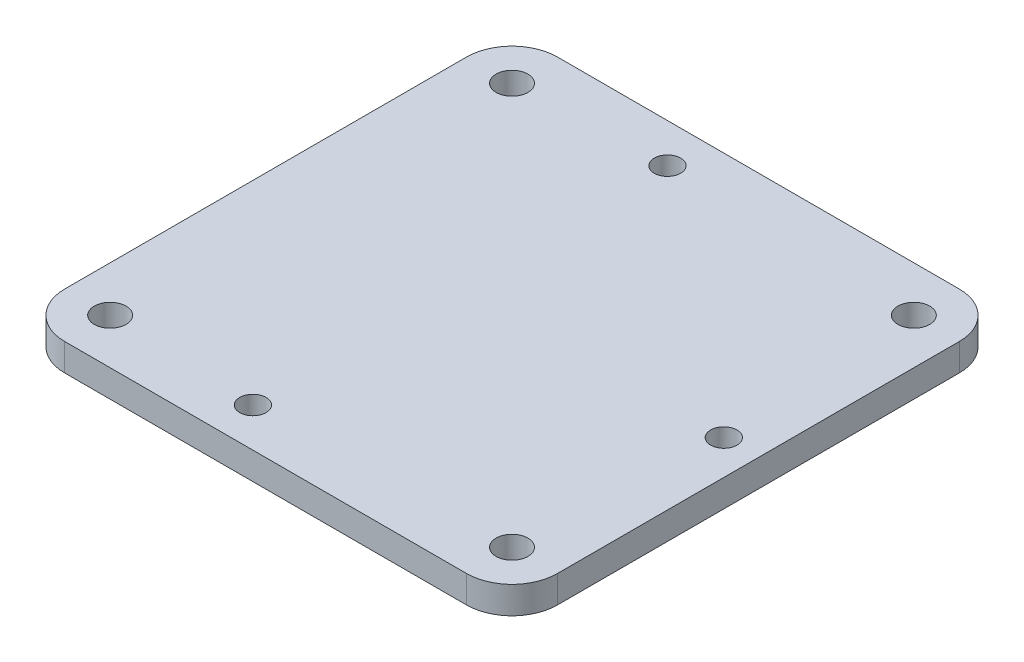
from build123d import *

# Parameters (mm, degrees)
SKETCH1_W           = 54.2
SKETCH1_H           = 54.2
SKETCH1_R           = 1.45
SKETCH1_R_2         = 1.75
BOSS_EXTRUDE1_DEPTH = 3
FILLET1_R           = 5


with BuildPart() as part:
    # Sketch1 → Boss-Extrude1 (new body)
    with BuildSketch(Plane(origin=(0, 0, 0), x_dir=(1, 0, 0), z_dir=(0, 1, 0))):
        with Locations((27.1, 27.1)):
            Rectangle(SKETCH1_W, SKETCH1_H)
        with Locations((21.4, 49.9)):
            Circle(SKETCH1_R, mode=Mode.SUBTRACT)
        with Locations((21.4, 4.3)):
            Circle(SKETCH1_R, mode=Mode.SUBTRACT)
        with Locations((50.4, 27.1)):
            Circle(SKETCH1_R, mode=Mode.SUBTRACT)
        with Locations((5, 49.2)):
            Circle(SKETCH1_R_2, mode=Mode.SUBTRACT)
        with Locations((49.2, 49.2)):
            Circle(SKETCH1_R_2, mode=Mode.SUBTRACT)
        with Locations((49.2, 5)):
            Circle(SKETCH1_R_2, mode=Mode.SUBTRACT)
        with Locations((5, 5)):
            Circle(SKETCH1_R_2, mode=Mode.SUBTRACT)
    extrude(amount=BOSS_EXTRUDE1_DEPTH)

    # Fillet1
    fillet1_edges = [part.edges().sort_by_distance(p)[0] for p in [
        (54.2, 1.5, -54.2),
        (54.2, 1.5, 0),
        (0, 1.5, 0),
        (0, 1.5, -54.2),
    ]]
    fillet(fillet1_edges, radius=FILLET1_R)


solid = part.part
